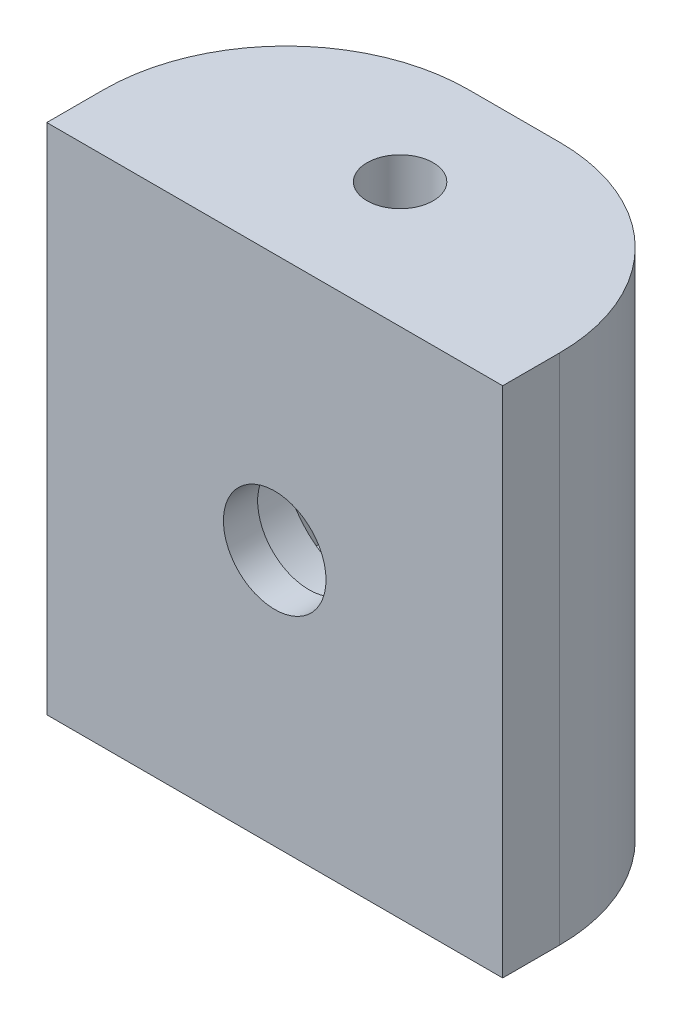
from build123d import *

# Parameters (mm, degrees)
SKETCH1_W           = 20
SKETCH1_H           = 22.5
BOSS_EXTRUDE1_DEPTH = 4
SKETCH2_R           = 2.25
CUT_EXTRUDE1_DEPTH  = 1.5
SKETCH3_R           = 3.65
CUT_EXTRUDE2_DEPTH  = 2.5
SKETCH4_W           = 4
SKETCH4_H           = 13.5
BOSS_EXTRUDE2_DEPTH = 6.5
SKETCH5_R           = 1.45
CUT_EXTRUDE3_DEPTH  = 31.797727189
FILLET1_R           = 8


with BuildPart() as part:
    # Sketch1 → Boss-Extrude1 (new body)
    with BuildSketch(Plane.XY):
        with Locations((10, -11.25)):
            Rectangle(SKETCH1_W, SKETCH1_H)
    extrude(amount=BOSS_EXTRUDE1_DEPTH)

    # Sketch2 → Cut-Extrude1 (cut)
    with BuildSketch(Plane.XY.offset(4)):
        with Locations((10, -11.25)):
            Circle(SKETCH2_R)
    extrude(amount=-CUT_EXTRUDE1_DEPTH, mode=Mode.SUBTRACT)

    # Sketch3 → Cut-Extrude2 (cut)
    with BuildSketch(Plane.XY.offset(2.5)):
        with Locations((10, -11.25)):
            Circle(SKETCH3_R)
    extrude(amount=-CUT_EXTRUDE2_DEPTH, mode=Mode.SUBTRACT)

    # Sketch4 → Boss-Extrude2 (add)
    with BuildSketch(Plane(origin=(0, 0, 0), x_dir=(-1, 0, 0), z_dir=(0, 0, -1))):
        with Locations((-18, -11.25)):
            Rectangle(SKETCH4_W, SKETCH4_H)
        Polygon((0, 0), (-20, 0), (-20, -4.5), (-16, -4.5), (-4, -4.5), (0, -4.5), align=None)
        with Locations((-2, -11.25)):
            Rectangle(SKETCH4_W, SKETCH4_H)
        Polygon((-16, -18), (-20, -18), (-20, -22.5), (0, -22.5), (0, -18), (-4, -18), align=None)
    extrude(amount=BOSS_EXTRUDE2_DEPTH)

    # Sketch5 → Cut-Extrude3 (cut, through all)
    with BuildSketch(Plane(origin=(0, 0, 0), x_dir=(1, 0, 0), z_dir=(0, 1, 0))):
        with Locations(Location((10, 1.5, 0), (0, 0, 270))):
            Circle(SKETCH5_R)
    extrude(amount=-CUT_EXTRUDE3_DEPTH, mode=Mode.SUBTRACT)

    # Fillet1
    # the kernel refuses this fillet: 8 mm, written as the material it takes off along each edge
    with BuildSketch(Plane(origin=(0, -42.5, -6.5), x_dir=(0, 0, 1), z_dir=(0, 1, 0)), Plane(origin=(20, 20, -6.5), x_dir=(0, 0, 1), z_dir=(0, -1, 0))) as fillet1_piece_1:
        with BuildLine():
            CenterArc((FILLET1_R, FILLET1_R), FILLET1_R, 180, 90)
            Line((0, FILLET1_R), (0, 0))
            Line((0, 0), (FILLET1_R, 0))
        make_face()
    extrude(amount=62.5, mode=Mode.SUBTRACT)


solid = part.part
